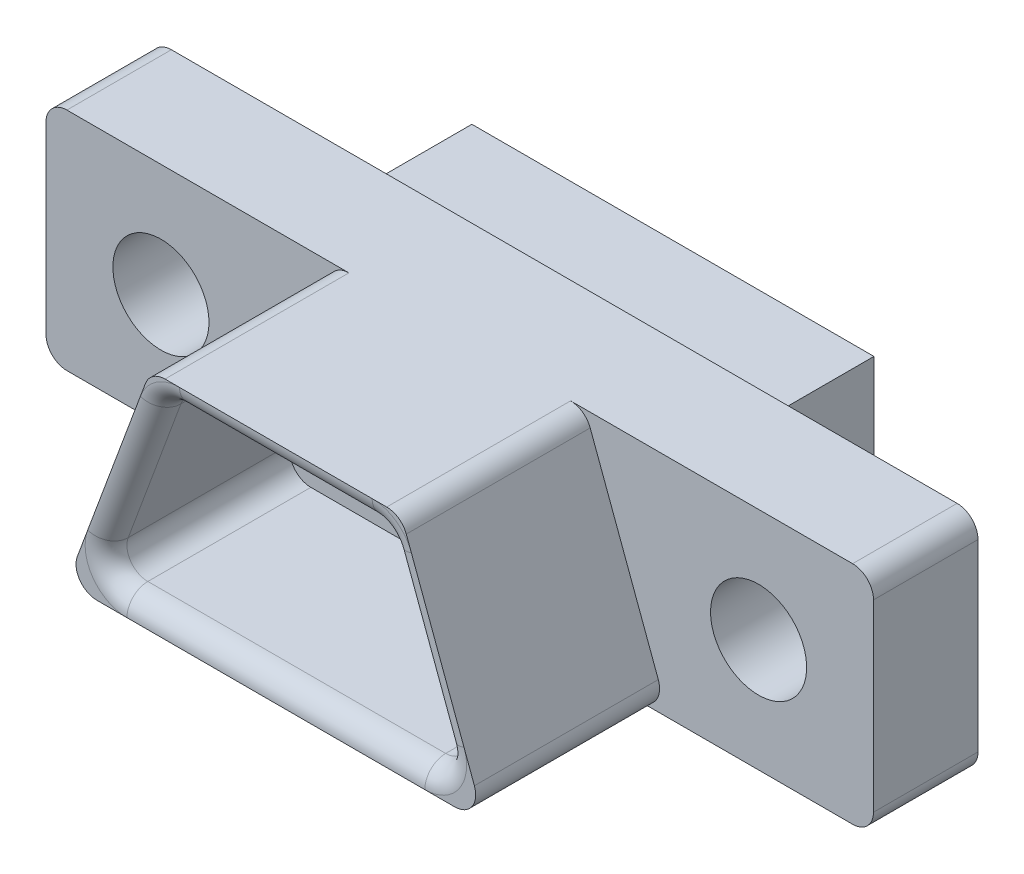
from build123d import *

# Parameters (mm, degrees)
SKETCH_1_W          = 19.8
SKETCH_1_H          = 5.4
SKETCH_1_R          = 1.15
EXTRUDE_1_DEPTH     = 2.5
FILLET_1_R          = 0.5
FILLET_2_R          = 0.5
SKETCH_3_W          = 9.62
SKETCH_3_H          = 4.3
EXTRUDE_2_DEPTH     = 2.6
SKETCH_4_R          = 0.31
CUT_EXTRUDE_1_DEPTH = 4.5
EXTRUDE_3_DEPTH     = 4.4
FILLET_3_R          = 0.5


with BuildPart() as part:
    # 草图1 → 凸台-拉伸1 (new body)
    with BuildSketch(Plane.XY):
        Rectangle(SKETCH_1_W, SKETCH_1_H)
        with Locations((-7.15, 0)):
            Circle(SKETCH_1_R, mode=Mode.SUBTRACT)
        with Locations(Location((7.15, 0, 0), (0, 0, 180))):
            Circle(SKETCH_1_R, mode=Mode.SUBTRACT)
    extrude(amount=EXTRUDE_1_DEPTH)

    # 圆角1
    fillet_1_edges = [part.edges().sort_by_distance(p)[0] for p in [
        (-9.9, 2.7, 1.25),
    ]]
    fillet(fillet_1_edges, radius=FILLET_1_R)

    # 圆角2
    fillet_2_edges = [part.edges().sort_by_distance(p)[0] for p in [
        (9.9, 2.7, 1.25),
        (9.9, -2.7, 1.25),
        (-9.9, -2.7, 1.25),
    ]]
    fillet(fillet_2_edges, radius=FILLET_2_R)

    # 草图3 → 凸台-拉伸2 (add)
    with BuildSketch(Plane(origin=(0, 0, 0), x_dir=(-1, 0, 0), z_dir=(0, 0, -1))):
        Rectangle(SKETCH_3_W, SKETCH_3_H)
    extrude(amount=EXTRUDE_2_DEPTH)

    # 草图4 → 切除-拉伸1 (cut)
    with BuildSketch(Plane(origin=(0, 0, -2.6), x_dir=(-1, 0, 0), z_dir=(0, 0, -1))):
        with Locations((-1.905, 0.55)):
            Circle(SKETCH_4_R)
        with Locations((-0.635, 0.55)):
            Circle(SKETCH_4_R)
        with Locations((0.635, 0.55)):
            Circle(SKETCH_4_R)
        with Locations((1.905, 0.55)):
            Circle(SKETCH_4_R)
        with Locations(Location((-2.54, -0.55, 0), (0, 0, 180))):
            Circle(SKETCH_4_R)
        with Locations(Location((-1.27, -0.55, 0), (0, 0, 180))):
            Circle(SKETCH_4_R)
        with Locations(Location((0, -0.55, 0), (0, 0, 180))):
            Circle(SKETCH_4_R)
        with Locations(Location((1.27, -0.55, 0), (0, 0, 180))):
            Circle(SKETCH_4_R)
        with Locations(Location((2.54, -0.55, 0), (0, 0, 180))):
            Circle(SKETCH_4_R)
    extrude(amount=-CUT_EXTRUDE_1_DEPTH, mode=Mode.SUBTRACT)

    # 草图5 → 凸台-拉伸3 (add)
    with BuildSketch(Plane.XY.offset(2.5)):
        with BuildLine():
            Line((-2.651993332, 2.7), (2.651993332, 2.7))
            ThreePointArc((2.651993332, 2.7), (2.937625447, 2.610383107), (3.120867712, 2.373657178))
            Line((3.120867712, 2.373657178), (4.750497342, -2.026342822))
            ThreePointArc((4.750497342, -2.026342822), (4.692006068, -2.485632116), (4.281622961, -2.7))
            Line((4.281622961, -2.7), (-4.281622961, -2.7))
            ThreePointArc((-4.281622961, -2.7), (-4.692006068, -2.485632116), (-4.750497342, -2.026342822))
            Line((-4.750497342, -2.026342822), (-3.120867712, 2.373657178))
            ThreePointArc((-3.120867712, 2.373657178), (-2.937625447, 2.610383107), (-2.651993332, 2.7))
        make_face()
        with BuildLine():
            Line((-2.303986663, 2.2), (2.303986663, 2.2))
            ThreePointArc((2.303986663, 2.2), (2.589618779, 2.110383107), (2.772861043, 1.873657178))
            Line((2.772861043, 1.873657178), (4.032120303, -1.526342822))
            ThreePointArc((4.032120303, -1.526342822), (3.973629029, -1.985632116), (3.563245922, -2.2))
            Line((3.563245922, -2.2), (-3.563245922, -2.2))
            ThreePointArc((-3.563245922, -2.2), (-3.973629029, -1.985632116), (-4.032120303, -1.526342822))
            Line((-4.032120303, -1.526342822), (-2.772861043, 1.873657178))
            ThreePointArc((-2.772861043, 1.873657178), (-2.589618779, 2.110383107), (-2.303986663, 2.2))
        make_face(mode=Mode.SUBTRACT)
    extrude(amount=EXTRUDE_3_DEPTH)

    # 圆角3
    fillet_3_edges = [part.edges().sort_by_distance(p)[0] for p in [
        (-3.973629029, -1.985632116, 6.9),
        (0, -2.2, 6.9),
        (3.973629029, -1.985632116, 6.9),
        (3.402490673, 0.173657178, 6.9),
        (2.589618779, 2.110383107, 6.9),
        (0, 2.2, 6.9),
        (-2.589618779, 2.110383107, 6.9),
        (-3.402490673, 0.173657178, 6.9),
    ]]
    fillet(fillet_3_edges, radius=FILLET_3_R - 0.0001)  # a hair under: the kernel refuses the full size


solid = part.part
